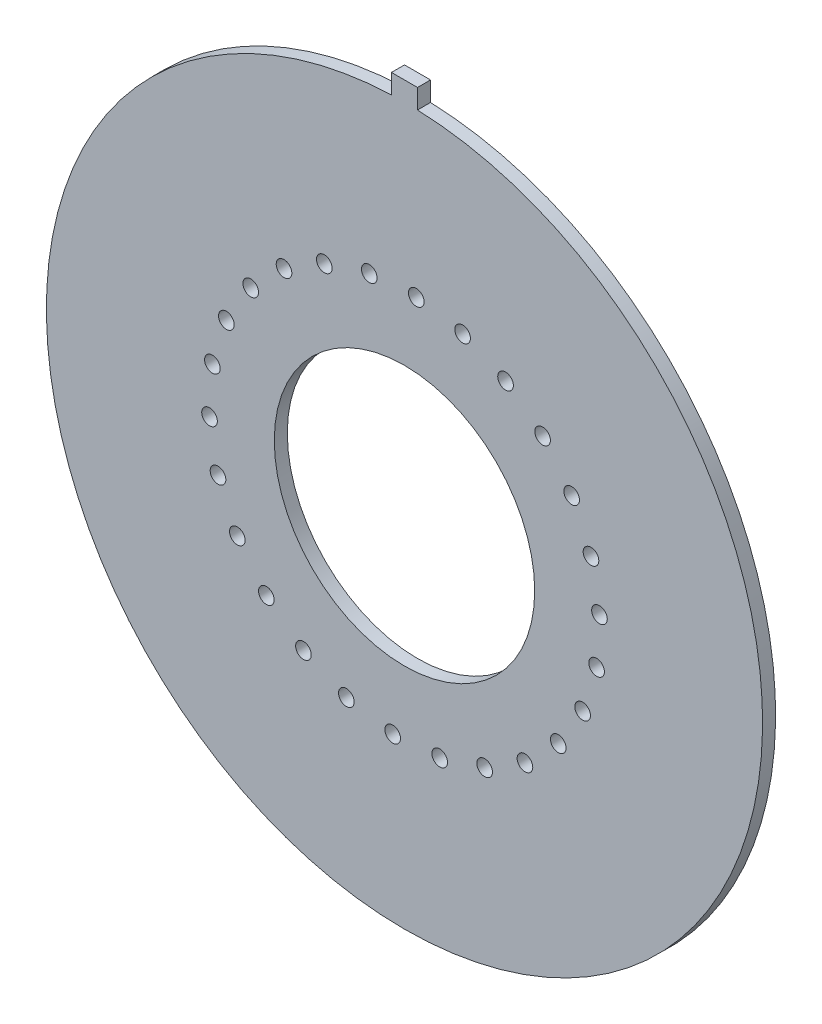
from build123d import *

# Parameters (mm, degrees)
PCB_DIMENSION_R     = 0.6
PCB_DIMENSION_R_2   = 10
BOSS_EXTRUDE1_DEPTH = 1


with BuildPart() as part:
    # PCB dimension → Boss-Extrude1 (new body)
    with BuildSketch(Plane.XY):
        with BuildLine():
            Line((-1, 27.481812167), (-1, 28.981812167))
            Line((-1, 28.981812167), (1, 28.981812167))
            Line((1, 28.981812167), (1, 27.481812167))
            ThreePointArc((1, 27.481812167), (0, -27.5), (-1, 27.481812167))
        make_face()
        with Locations((14.972633313, 0.905677461)):
            Circle(PCB_DIMENSION_R, mode=Mode.SUBTRACT)
        with Locations((14.754298604, -2.703825567)):
            Circle(PCB_DIMENSION_R, mode=Mode.SUBTRACT)
        with Locations((13.67849769, -6.156192082)):
            Circle(PCB_DIMENSION_R, mode=Mode.SUBTRACT)
        with Locations((11.807752209, -9.250783089)):
            Circle(PCB_DIMENSION_R, mode=Mode.SUBTRACT)
        with Locations((9.250783089, -11.807752209)):
            Circle(PCB_DIMENSION_R, mode=Mode.SUBTRACT)
        with Locations((6.156192082, -13.67849769)):
            Circle(PCB_DIMENSION_R, mode=Mode.SUBTRACT)
        with Locations((2.703825567, -14.754298604)):
            Circle(PCB_DIMENSION_R, mode=Mode.SUBTRACT)
        with Locations((-0.905677461, -14.972633313)):
            Circle(PCB_DIMENSION_R, mode=Mode.SUBTRACT)
        with Locations((-4.462545808, -14.320812998)):
            Circle(PCB_DIMENSION_R, mode=Mode.SUBTRACT)
        with Locations((-7.760067213, -12.836719085)):
            Circle(PCB_DIMENSION_R, mode=Mode.SUBTRACT)
        with Locations((-10.606601718, -10.606601718)):
            Circle(PCB_DIMENSION_R, mode=Mode.SUBTRACT)
        with Locations((-12.836719085, -7.760067213)):
            Circle(PCB_DIMENSION_R, mode=Mode.SUBTRACT)
        with Locations((-14.320812998, -4.462545808)):
            Circle(PCB_DIMENSION_R, mode=Mode.SUBTRACT)
        with Locations((-14.972633313, -0.905677461)):
            Circle(PCB_DIMENSION_R, mode=Mode.SUBTRACT)
        with Locations((-14.754298604, 2.703825567)):
            Circle(PCB_DIMENSION_R, mode=Mode.SUBTRACT)
        with Locations((-13.67849769, 6.156192082)):
            Circle(PCB_DIMENSION_R, mode=Mode.SUBTRACT)
        with Locations((-11.807752209, 9.250783089)):
            Circle(PCB_DIMENSION_R, mode=Mode.SUBTRACT)
        with Locations((-9.250783089, 11.807752209)):
            Circle(PCB_DIMENSION_R, mode=Mode.SUBTRACT)
        with Locations((-6.156192082, 13.67849769)):
            Circle(PCB_DIMENSION_R, mode=Mode.SUBTRACT)
        with Locations((-2.703825567, 14.754298604)):
            Circle(PCB_DIMENSION_R, mode=Mode.SUBTRACT)
        with Locations((0.905677461, 14.972633313)):
            Circle(PCB_DIMENSION_R, mode=Mode.SUBTRACT)
        with Locations((4.462545808, 14.320812998)):
            Circle(PCB_DIMENSION_R, mode=Mode.SUBTRACT)
        with Locations((7.760067213, 12.836719085)):
            Circle(PCB_DIMENSION_R, mode=Mode.SUBTRACT)
        with Locations((10.606601718, 10.606601718)):
            Circle(PCB_DIMENSION_R, mode=Mode.SUBTRACT)
        with Locations((12.836719085, 7.760067213)):
            Circle(PCB_DIMENSION_R, mode=Mode.SUBTRACT)
        with Locations((14.320812998, 4.462545808)):
            Circle(PCB_DIMENSION_R, mode=Mode.SUBTRACT)
        Circle(PCB_DIMENSION_R_2, mode=Mode.SUBTRACT)
    extrude(amount=BOSS_EXTRUDE1_DEPTH)


solid = part.part
